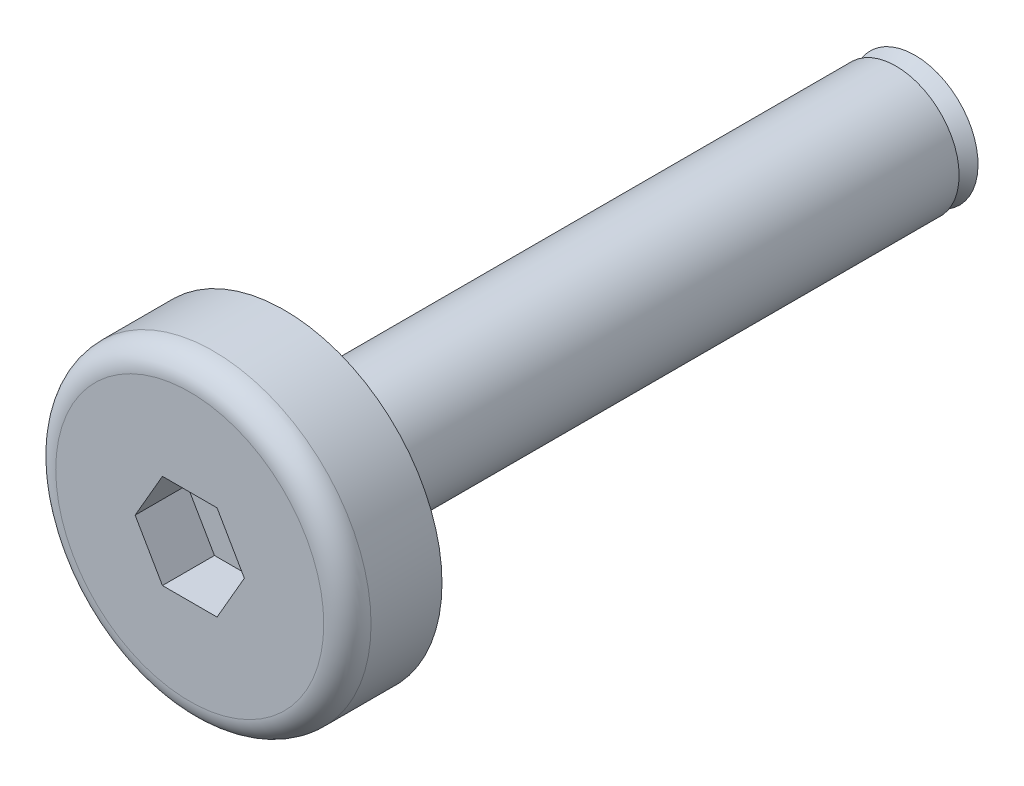
from build123d import *

# Parameters (mm, degrees)
F_0000_CYLINDER_SKETCH_R    = 2.5
F_0000_CYLINDER_DEPTH       = 1.5
F_0001_FILLET_R             = 0.375
F_0002_EXTRUDE_DEPTH        = 0.835
F_0002_EXTRUDE_ROTATE_ANGLE = 120
F_0005_CYLINDER_SKETCH_R    = 1
F_0005_CYLINDER_DEPTH       = 9.7
F_0006_CONE_ROTATE_ANGLE    = 90


with BuildPart() as part:
    # 0000_cylinder_Sketch → 0000_cylinder (new body)
    with BuildSketch(Plane.XY):
        Circle(F_0000_CYLINDER_SKETCH_R)
    extrude(amount=F_0000_CYLINDER_DEPTH)

    # 0001_fillet
    f_0001_fillet_edges = [part.edges().sort_by_distance(p)[0] for p in [
        (-2.5, 0, 1.5),
    ]]
    fillet(f_0001_fillet_edges, radius=F_0001_FILLET_R)


with BuildPart() as body_2:
    # 0002_extrude_Sketch → 0002_extrude (new body)
    with BuildSketch(Plane.XY):
        Polygon((0, 0), (0.866025404, 0), (1.299038106, 0.75), (0.866025404, 1.5), (0, 1.5), (-0.433012702, 0.75), align=None)
    extrude(amount=F_0002_EXTRUDE_DEPTH)


with BuildPart() as body_2_1:
    # 0002_extrude_Rotate: read off the stored shape, not the designer's step
    # 0002_extrude_Rotate: moved
    add(body_2.part.rotate(Axis((0, 0, 0), (0, 0, 1)), F_0002_EXTRUDE_ROTATE_ANGLE))


with BuildPart() as body_2_2:
    # 0002_extrude_Translate: moved
    add(body_2_1.part.moved(Location((0.866025404, 0, 0.675))))


with BuildPart() as part_1:
    add(part.part)

    # 0004_sub: cut body 2
    add(body_2_2.part, mode=Mode.SUBTRACT)


with BuildPart() as body_2_2_1:
    # 0005_cylinder_Sketch → 0005_cylinder (new body)
    with BuildSketch(Plane.XY):
        Circle(F_0005_CYLINDER_SKETCH_R)
    extrude(amount=F_0005_CYLINDER_DEPTH)


with BuildPart() as body_2_2_2:
    # 0005_cylinder_Translate: moved
    add(body_2_2_1.part.moved(Location((0, 0, -9.7))))


with BuildPart() as body_3:
    # 0006_cone_Sketch → 0006_cone (revolve)
    with BuildSketch(Plane.XY, mode=Mode.PRIVATE) as f_0006_cone_sk:
        Polygon((0, 0), (1, 0), (0.7, 0.3), (0, 0.3), align=None)
    revolve(f_0006_cone_sk.sketch.rotate(Axis((0, -100, 0), (0, 1, 0)), 90), axis=Axis((0, -100, 0), (0, 1, 0)))


with BuildPart() as body_3_1:
    # 0006_cone_Rotate: moved
    add(body_3.part.rotate(Axis((0, 0, 0), (1, 0, 0)), F_0006_CONE_ROTATE_ANGLE))


with BuildPart() as body_3_2:
    # 0006_cone_Translate: moved
    add(body_3_1.part.moved(Location((0, 0, -10))))


with BuildPart() as body_2_2_3:
    add(body_2_2_2.part)

    # 0008_add: union body 3
    add(body_3_2.part)


with BuildPart() as part_2:
    add(part_1.part)

    # 0009_add: union body 2 2
    add(body_2_2_3.part)


solid = part_2.part
